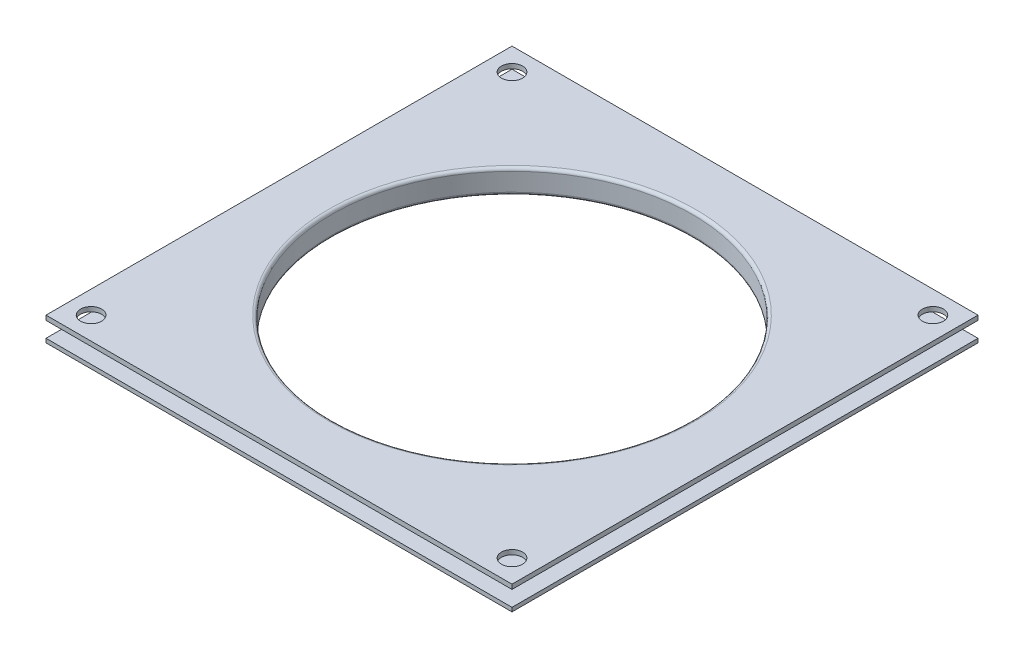
from build123d import *

# Parameters (mm, degrees)
CROQUIS1_W              = 155
CROQUIS1_H              = 155
CROQUIS1_R              = 60
SALIENTE_EXTRUIR1_DEPTH = 8
CORTAR_EXTRUIR4_REACH   = 111.893
CROQUIS3_R              = 3.5
REDONDEO1_R             = 1
CORTAR_EXTRUIR5_REACH   = 111.893
CROQUIS4_R              = 2.5


with BuildPart() as part:
    # Croquis1 → Saliente-Extruir1 (new body)
    with BuildSketch(Plane(origin=(0, 0, 0), x_dir=(1, 0, 0), z_dir=(0, 1, 0))):
        Rectangle(CROQUIS1_W, CROQUIS1_H)
        Circle(CROQUIS1_R, mode=Mode.SUBTRACT)
    extrude(amount=SALIENTE_EXTRUIR1_DEPTH)

    # Croquis2 → Cortar-Revolución1 (revolve, cut)
    with BuildSketch(Plane.XY):
        with BuildLine():
            Line((63.057831326, 6.474140719), (73.221363367, 6.474140719))
            Line((73.221363367, 6.474140719), (118.605663226, 6.474140719))
            Line((118.605663226, 6.474140719), (118.605663226, 1.329441432))
            Line((118.605663226, 1.329441432), (77.5, 1.329441432))
            Line((77.5, 1.329441432), (62.888920691, 1.329441432))
            ThreePointArc((62.888920691, 1.329441432), (61.030350251, 3.965584448), (63.057831326, 6.474140719))
        make_face()
    revolve(axis=Axis((0, 0, 0), (0, 1, 0)), mode=Mode.SUBTRACT)

    # Croquis3 → Cortar-Extruir4 (cut, up to next)
    with BuildSketch(Plane(origin=(0, 8, 0), x_dir=(1, 0, 0), z_dir=(0, 1, 0)), mode=Mode.PRIVATE) as cortar_extruir4_sk1:
        with Locations((70, 70)):
            Circle(CROQUIS3_R)
    cortar_extruir4_tool1 = extrude(cortar_extruir4_sk1.sketch, amount=-CORTAR_EXTRUIR4_REACH, mode=Mode.PRIVATE) & part.part
    # Croquis3 → Cortar-Extruir4 (cut, up to next)
    with BuildSketch(Plane(origin=(0, 8, 0), x_dir=(1, 0, 0), z_dir=(0, 1, 0)), mode=Mode.PRIVATE) as cortar_extruir4_sk2:
        with Locations((-70, 70)):
            Circle(CROQUIS3_R)
    cortar_extruir4_tool2 = extrude(cortar_extruir4_sk2.sketch, amount=-CORTAR_EXTRUIR4_REACH, mode=Mode.PRIVATE) & part.part
    # Croquis3 → Cortar-Extruir4 (cut, up to next)
    with BuildSketch(Plane(origin=(0, 8, 0), x_dir=(1, 0, 0), z_dir=(0, 1, 0)), mode=Mode.PRIVATE) as cortar_extruir4_sk3:
        with Locations((-70, -70)):
            Circle(CROQUIS3_R)
    cortar_extruir4_tool3 = extrude(cortar_extruir4_sk3.sketch, amount=-CORTAR_EXTRUIR4_REACH, mode=Mode.PRIVATE) & part.part
    # Croquis3 → Cortar-Extruir4 (cut, up to next)
    with BuildSketch(Plane(origin=(0, 8, 0), x_dir=(1, 0, 0), z_dir=(0, 1, 0)), mode=Mode.PRIVATE) as cortar_extruir4_sk4:
        with Locations((70, -70)):
            Circle(CROQUIS3_R)
    cortar_extruir4_tool4 = extrude(cortar_extruir4_sk4.sketch, amount=-CORTAR_EXTRUIR4_REACH, mode=Mode.PRIVATE) & part.part
    add(cortar_extruir4_tool1.solids().sort_by_distance((70, 8, -70))[0], mode=Mode.SUBTRACT)
    add(cortar_extruir4_tool2.solids().sort_by_distance((-70, 8, -70))[0], mode=Mode.SUBTRACT)
    add(cortar_extruir4_tool3.solids().sort_by_distance((-70, 8, 70))[0], mode=Mode.SUBTRACT)
    add(cortar_extruir4_tool4.solids().sort_by_distance((70, 8, 70))[0], mode=Mode.SUBTRACT)

    # Redondeo1
    redondeo1_edges = [part.edges().sort_by_distance(p)[0] for p in [
        (-60, 0, 0),
        (-60, 8, 0),
    ]]
    fillet(redondeo1_edges, radius=REDONDEO1_R)

    # Croquis4 → Cortar-Extruir5 (cut, up to next)
    with BuildSketch(Plane.XZ, mode=Mode.PRIVATE) as cortar_extruir5_sk1:
        with Locations((-60, 60)):
            Circle(CROQUIS4_R)
    cortar_extruir5_tool1 = extrude(cortar_extruir5_sk1.sketch, amount=-CORTAR_EXTRUIR5_REACH, mode=Mode.PRIVATE) & part.part
    # Croquis4 → Cortar-Extruir5 (cut, up to next)
    with BuildSketch(Plane.XZ, mode=Mode.PRIVATE) as cortar_extruir5_sk2:
        with Locations((60, 60)):
            Circle(CROQUIS4_R)
    cortar_extruir5_tool2 = extrude(cortar_extruir5_sk2.sketch, amount=-CORTAR_EXTRUIR5_REACH, mode=Mode.PRIVATE) & part.part
    # Croquis4 → Cortar-Extruir5 (cut, up to next)
    with BuildSketch(Plane.XZ, mode=Mode.PRIVATE) as cortar_extruir5_sk3:
        with Locations((60, -60)):
            Circle(CROQUIS4_R)
    cortar_extruir5_tool3 = extrude(cortar_extruir5_sk3.sketch, amount=-CORTAR_EXTRUIR5_REACH, mode=Mode.PRIVATE) & part.part
    # Croquis4 → Cortar-Extruir5 (cut, up to next)
    with BuildSketch(Plane.XZ, mode=Mode.PRIVATE) as cortar_extruir5_sk4:
        with Locations((-60, -60)):
            Circle(CROQUIS4_R)
    cortar_extruir5_tool4 = extrude(cortar_extruir5_sk4.sketch, amount=-CORTAR_EXTRUIR5_REACH, mode=Mode.PRIVATE) & part.part
    add(cortar_extruir5_tool1.solids().sort_by_distance((-60, 0, 60))[0], mode=Mode.SUBTRACT)
    add(cortar_extruir5_tool2.solids().sort_by_distance((60, 0, 60))[0], mode=Mode.SUBTRACT)
    add(cortar_extruir5_tool3.solids().sort_by_distance((60, 0, -60))[0], mode=Mode.SUBTRACT)
    add(cortar_extruir5_tool4.solids().sort_by_distance((-60, 0, -60))[0], mode=Mode.SUBTRACT)


solid = part.part
